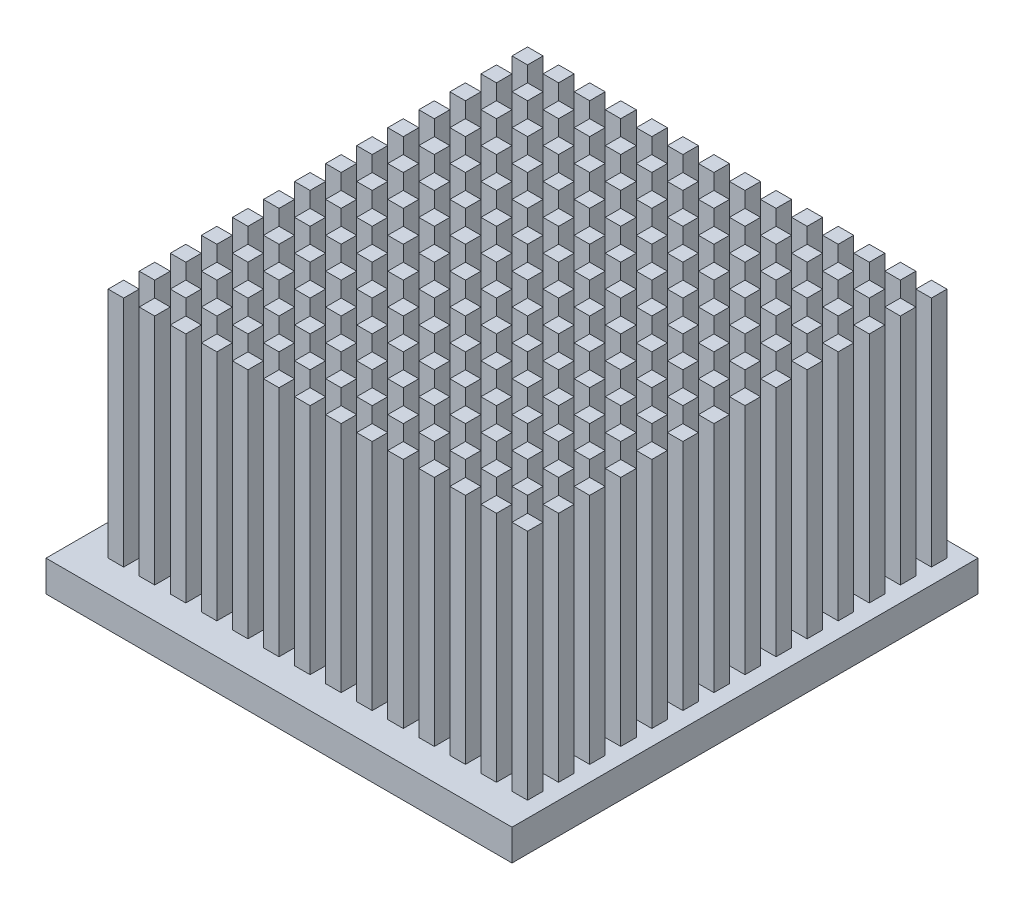
from build123d import *

# Parameters (mm, degrees)
BOSS_EXTRUDE1_DEPTH      = 75
BOSS_EXTRUDE1_DEPTH_BACK = 75
SKETCH1_W                = 150
SKETCH1_H                = 10
SKETCH2_W                = 5
SKETCH2_H                = 5
BOSS_EXTRUDE2_DEPTH      = 75
LPATTERN1_COUNT          = 14
LPATTERN1_PITCH          = 10
LPATTERN1_COUNT_DIR2     = 14
LPATTERN1_PITCH_DIR2     = 10


with BuildPart() as part:
    # Sketch1 → Boss-Extrude1 (new, two sides: drawn at the far end of the back side and taken through both)
    with BuildSketch(Plane.XY.offset(-BOSS_EXTRUDE1_DEPTH_BACK)):
        Rectangle(SKETCH1_W, SKETCH1_H)
    extrude(amount=BOSS_EXTRUDE1_DEPTH + BOSS_EXTRUDE1_DEPTH_BACK)

    # Sketch2 → Boss-Extrude2 (add)
    with BuildSketch(Plane(origin=(0, 5, 0), x_dir=(1, 0, 0), z_dir=(0, 1, 0))):
        with Locations((67.5, 67.5)):
            Rectangle(SKETCH2_W, SKETCH2_H)
    boss_extrude2 = extrude(amount=BOSS_EXTRUDE2_DEPTH)

    # LPattern1: Boss-Extrude2 14 × 14
    with Locations(*[(-j * LPATTERN1_PITCH_DIR2, 0, i * LPATTERN1_PITCH) for i in range(LPATTERN1_COUNT) for j in range(LPATTERN1_COUNT_DIR2) if (i, j) != (0, 0)]):
        add(boss_extrude2)


solid = part.part
